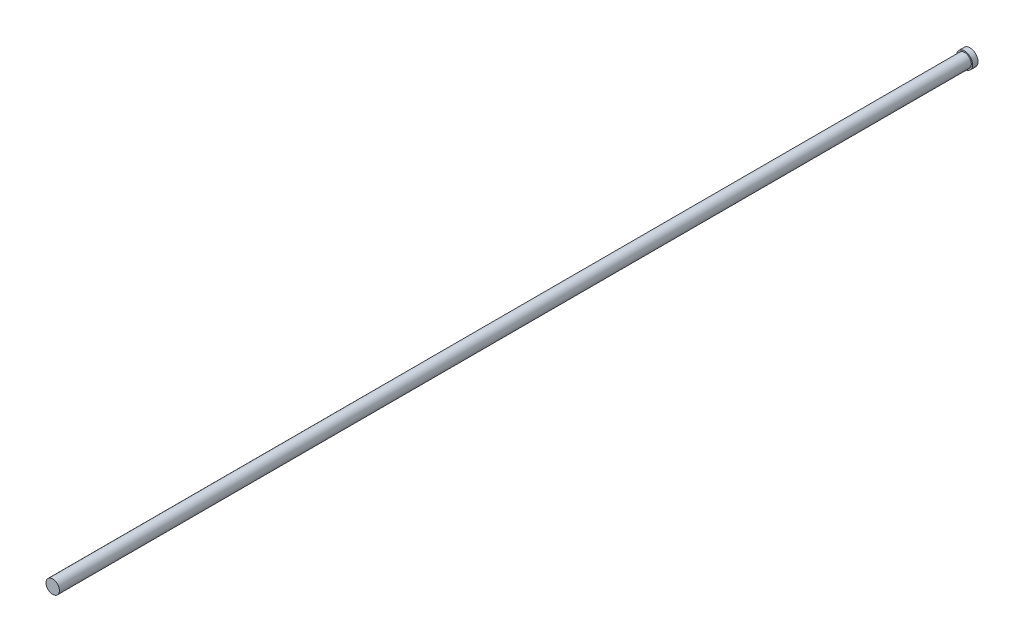
from build123d import *

# Parameters (mm, degrees)
SKETCH2_R           = 2.5
BOSS_EXTRUDE1_DEPTH = 340
SKETCH2_5_R         = 3
BOSS_EXTRUDE2_DEPTH = 2


with BuildPart() as part:
    # Sketch2 → Boss-Extrude1 (new body)
    with BuildSketch(Plane.XY):
        with Locations((-13.086903186, 5.549189199)):
            Circle(SKETCH2_R)
    extrude(amount=BOSS_EXTRUDE1_DEPTH)

    # Sketch2<5> → Boss-Extrude2 (add)
    with BuildSketch(Plane.XY):
        with Locations((-13.087932039, 5.568430377)):
            Circle(SKETCH2_5_R)
    extrude(amount=-BOSS_EXTRUDE2_DEPTH)


solid = part.part
